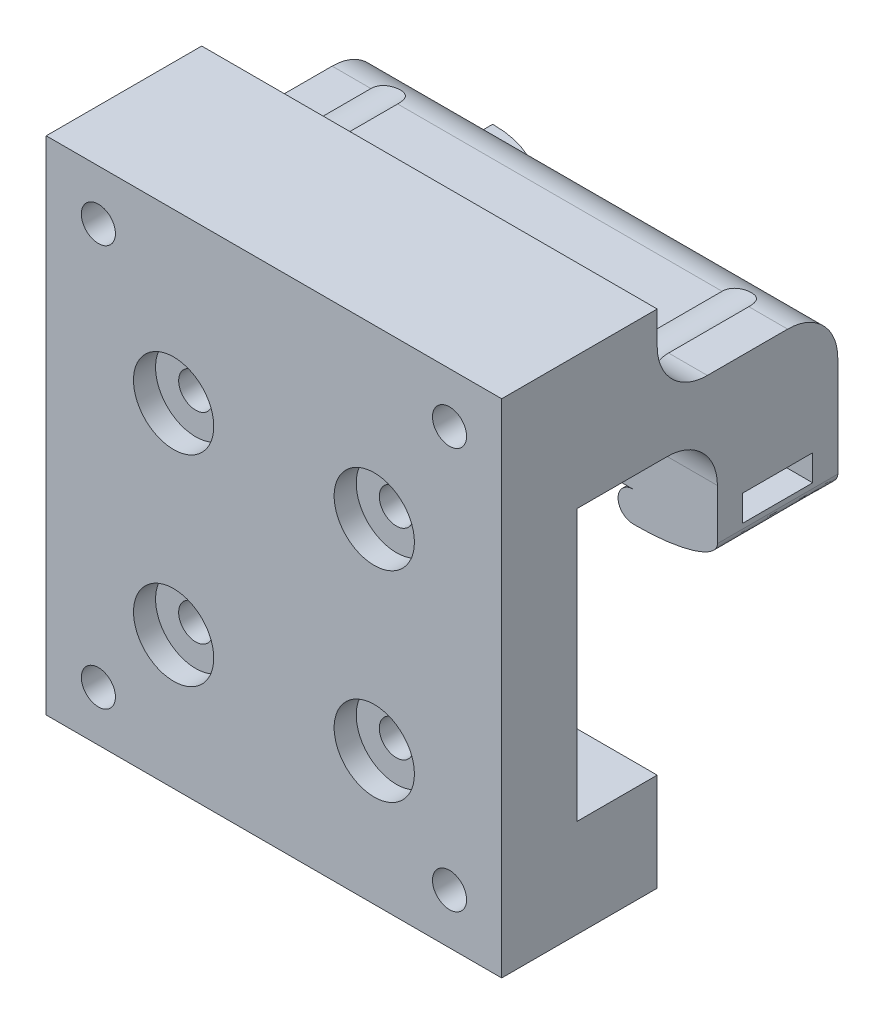
from build123d import *

# Parameters (mm, degrees)
SKETCH1_W           = 45.4
SKETCH1_H           = 50
BOSS_EXTRUDE1_DEPTH = 15.5
SKETCH2_W           = 45.4
SKETCH2_H           = 27
CUT_EXTRUDE1_DEPTH  = 8
SKETCH7_W           = 45.4
SKETCH7_H           = 5
BOSS_EXTRUDE2_DEPTH = 18
SKETCH8_W           = 45.4
SKETCH8_H           = 12
BOSS_EXTRUDE3_DEPTH = 12.52
CUT_EXTRUDE2_REACH  = 77.388
SKETCH11_W          = 7
SKETCH11_H          = 2.6
CUT_EXTRUDE3_DEPTH  = 70.893919621
FILLET1_SIZE        = 2.5
FILLET1_SIZE_2      = 8
CUT_EXTRUDE4_REACH  = 77.388
SKETCH13_R          = 1.7
SKETCH14_W          = 8
SKETCH14_H          = 1.5
BOSS_EXTRUDE4_DEPTH = 11
FILLET3_R           = 10
FILLET4_R           = 10
SKETCH15_R          = 1.7
CUT_EXTRUDE6_DEPTH  = 81.878983729
SKETCH16_R          = 3.5
CUT_EXTRUDE7_DEPTH  = 80.267963321
SKETCH17_R          = 4
CUT_EXTRUDE8_DEPTH  = 2.2
FILLET5_R           = 5
FILLET6_R           = 5
FILLET7_R           = 5
SKETCH18_R          = 1.35
CUT_EXTRUDE9_DEPTH  = 10


with BuildPart() as part:
    # Sketch1 → Boss-Extrude1 (new body)
    with BuildSketch(Plane.XY):
        with Locations((22.7, 25)):
            Rectangle(SKETCH1_W, SKETCH1_H)
    extrude(amount=BOSS_EXTRUDE1_DEPTH)

    # Sketch2 → Cut-Extrude1 (cut)
    with BuildSketch(Plane(origin=(0, 0, 0), x_dir=(-1, 0, 0), z_dir=(0, 0, -1))):
        with Locations((-22.7, 23.263256753)):
            Rectangle(SKETCH2_W, SKETCH2_H)
    extrude(amount=-CUT_EXTRUDE1_DEPTH, mode=Mode.SUBTRACT)

    # Sketch7 → Boss-Extrude2 (add)
    with BuildSketch(Plane(origin=(0, 0, 0), x_dir=(-1, 0, 0), z_dir=(0, 0, -1))):
        with Locations((-22.7, 39.263256753)):
            Rectangle(SKETCH7_W, SKETCH7_H)
    extrude(amount=BOSS_EXTRUDE2_DEPTH)

    # Sketch8 → Boss-Extrude3 (add)
    with BuildSketch(Plane.XZ.offset(-36.763256753)):
        with Locations((22.7, -12)):
            Rectangle(SKETCH8_W, SKETCH8_H)
    extrude(amount=BOSS_EXTRUDE3_DEPTH)

    # Sketch10 → Cut-Extrude2 (cut, up to next)
    with BuildSketch(Plane(origin=(0, 0, -18), x_dir=(-1, 0, 0), z_dir=(0, 0, -1)), mode=Mode.PRIVATE) as cut_extrude2_sk1:
        with BuildLine():
            Line((-37, 27.243256753), (-8, 27.243256753))
            ThreePointArc((-8, 27.243256753), (-9.5, 25.743256753), (-8, 24.243256753))
            Line((-8, 24.243256753), (-37, 24.243256753))
            ThreePointArc((-37, 24.243256753), (-35.5, 25.743256753), (-37, 27.243256753))
        make_face()
    cut_extrude2_tool1 = extrude(cut_extrude2_sk1.sketch, amount=-CUT_EXTRUDE2_REACH, mode=Mode.PRIVATE) & part.part
    add(cut_extrude2_tool1.solids().sort_by_distance((22.5, 25.743257, -18))[0], mode=Mode.SUBTRACT)

    # Sketch11 → Cut-Extrude3 (cut, through all)
    with BuildSketch(Plane(origin=(45.4, 0, 0), x_dir=(0, 0, -1), z_dir=(1, 0, 0))):
        with Locations((12, 28.543256753)):
            Rectangle(SKETCH11_W, SKETCH11_H)
    extrude(amount=-CUT_EXTRUDE3_DEPTH, mode=Mode.SUBTRACT)

    # Fillet1
    # an asymmetric fillet: 8, 2.5 mm, written as the material it takes off along each edge
    with BuildSketch(Plane(origin=(0, 24.243256753, 14), x_dir=(0, 1, 0), z_dir=(0, 0, -1))) as fillet1_piece_1_section:
        with BuildLine():
            Bezier((FILLET1_SIZE, 0), (0, 0), (0, FILLET1_SIZE_2), weights=[1, 0.707106781, 1])
            Line((0, FILLET1_SIZE_2), (0, 0))
            Line((0, 0), (FILLET1_SIZE, 0))
        make_face()
    fillet1_piece_1 = extrude(amount=52, mode=Mode.PRIVATE)
    fillet1_piece_1 = split(fillet1_piece_1, bisect_by=Plane(origin=(1.786931274, 24.8016736, 8), z_dir=(0, 0, -1)), keep=Keep.TOP, mode=Mode.PRIVATE)
    add(fillet1_piece_1, mode=Mode.SUBTRACT)
    with BuildSketch(Plane(origin=(45.4, 24.243256753, -38), x_dir=(0, 1, 0), z_dir=(0, 0, 1))) as fillet1_piece_2_section:
        with BuildLine():
            Bezier((FILLET1_SIZE, 0), (0, 0), (0, FILLET1_SIZE_2), weights=[1, 0.707106781, 1])
            Line((0, FILLET1_SIZE_2), (0, 0))
            Line((0, 0), (FILLET1_SIZE, 0))
        make_face()
    fillet1_piece_2 = extrude(amount=52, mode=Mode.PRIVATE)
    fillet1_piece_2 = split(fillet1_piece_2, bisect_by=Plane(origin=(43.613068726, 24.8016736, 8), z_dir=(0, 0, -1)), keep=Keep.TOP, mode=Mode.PRIVATE)
    add(fillet1_piece_2, mode=Mode.SUBTRACT)

    # Sketch13 → Cut-Extrude4 (cut, up to next)
    with BuildSketch(Plane.XY.offset(15.5), mode=Mode.PRIVATE) as cut_extrude4_sk1:
        with Locations((12.7, 33.263245951)):
            Circle(SKETCH13_R)
    cut_extrude4_tool1 = extrude(cut_extrude4_sk1.sketch, amount=-CUT_EXTRUDE4_REACH, mode=Mode.PRIVATE) & part.part
    # Sketch13 → Cut-Extrude4 (cut, up to next)
    with BuildSketch(Plane.XY.offset(15.5), mode=Mode.PRIVATE) as cut_extrude4_sk2:
        with Locations((32.7, 33.263245951)):
            Circle(SKETCH13_R)
    cut_extrude4_tool2 = extrude(cut_extrude4_sk2.sketch, amount=-CUT_EXTRUDE4_REACH, mode=Mode.PRIVATE) & part.part
    # Sketch13 → Cut-Extrude4 (cut, up to next)
    with BuildSketch(Plane.XY.offset(15.5), mode=Mode.PRIVATE) as cut_extrude4_sk3:
        with Locations((32.7, 13.263245951)):
            Circle(SKETCH13_R)
    cut_extrude4_tool3 = extrude(cut_extrude4_sk3.sketch, amount=-CUT_EXTRUDE4_REACH, mode=Mode.PRIVATE) & part.part
    # Sketch13 → Cut-Extrude4 (cut, up to next)
    with BuildSketch(Plane.XY.offset(15.5), mode=Mode.PRIVATE) as cut_extrude4_sk4:
        with Locations((12.7, 13.263245951)):
            Circle(SKETCH13_R)
    cut_extrude4_tool4 = extrude(cut_extrude4_sk4.sketch, amount=-CUT_EXTRUDE4_REACH, mode=Mode.PRIVATE) & part.part
    add(cut_extrude4_tool1.solids().sort_by_distance((12.7, 33.263246, 15.5))[0], mode=Mode.SUBTRACT)
    add(cut_extrude4_tool2.solids().sort_by_distance((32.7, 33.263246, 15.5))[0], mode=Mode.SUBTRACT)
    add(cut_extrude4_tool3.solids().sort_by_distance((32.7, 13.263246, 15.5))[0], mode=Mode.SUBTRACT)
    add(cut_extrude4_tool4.solids().sort_by_distance((12.7, 13.263246, 15.5))[0], mode=Mode.SUBTRACT)

    # Sketch14 → Boss-Extrude4 (add)
    with BuildSketch(Plane(origin=(0, 0, -18), x_dir=(-1, 0, 0), z_dir=(0, 0, -1))):
        with Locations((-4, 27.993256753)):
            Rectangle(SKETCH14_W, SKETCH14_H)
    extrude(amount=BOSS_EXTRUDE4_DEPTH)

    # Fillet3
    # the kernel refuses this fillet: 10 mm, written as the material it adds along each edge
    with BuildSketch(Plane(origin=(8, 28.743256753, -18), x_dir=(1, 0, 0), z_dir=(0, -1, 0))) as fillet3_piece_1:
        with BuildLine():
            CenterArc((FILLET3_R, -FILLET3_R), FILLET3_R, 90, 90)
            Line((0, -FILLET3_R), (0, 0))
            Line((0, 0), (FILLET3_R, 0))
        make_face()
    extrude(amount=1.5)

    # Fillet4
    # the kernel refuses this fillet: 10 mm, written as the material it takes off along each edge
    with BuildSketch(Plane(origin=(8, 48.394684502, -29), x_dir=(-1, 0, 0), z_dir=(0, -1, 0))) as fillet4_piece_1:
        with BuildLine():
            CenterArc((7.860571099, -10), FILLET4_R, 90, 63.25631605)
            Line((-1.06971445, -5.5), (-1.962743005, -5.05))
            ThreePointArc((-1.962743005, -5.05), (-1, -1), (-1, 0))
            Line((-1, 0), (0, 1))
            Line((0, 1), (7.860571099, 1))
            Line((7.860571099, 1), (7.860571099, 0))
        make_face()
    extrude(amount=40.802855497, mode=Mode.SUBTRACT)

    # Sketch15 → Cut-Extrude6 (cut, through all)
    with BuildSketch(Plane(origin=(0, 0, 15.5), x_dir=(-1, 0, 0), z_dir=(0, 0, -1))):
        with Locations((-5.2, 45)):
            Circle(SKETCH15_R)
        with Locations((-40.2, 45)):
            Circle(SKETCH15_R)
        with Locations((-40.2, 5)):
            Circle(SKETCH15_R)
        with Locations((-5.2, 5)):
            Circle(SKETCH15_R)
    extrude(amount=CUT_EXTRUDE6_DEPTH, mode=Mode.SUBTRACT)

    # Sketch16 → Cut-Extrude7 (cut, through all)
    with BuildSketch(Plane.XY.offset(12.5)):
        with Locations((5.2, 45)):
            Circle(SKETCH16_R)
        with Locations((40.2, 45)):
            Circle(SKETCH16_R)
        with Locations((40.2, 5)):
            Circle(SKETCH16_R)
        with Locations((5.2, 5)):
            Circle(SKETCH16_R)
    extrude(amount=-CUT_EXTRUDE7_DEPTH, mode=Mode.SUBTRACT)

    # Sketch17 → Cut-Extrude8 (cut)
    with BuildSketch(Plane.XY.offset(15.5)):
        with Locations((12.7, 33.263245951)):
            Circle(SKETCH17_R)
        with Locations((32.7, 33.263245951)):
            Circle(SKETCH17_R)
        with Locations((32.7, 13.263245951)):
            Circle(SKETCH17_R)
        with Locations((12.7, 13.263245951)):
            Circle(SKETCH17_R)
    extrude(amount=-CUT_EXTRUDE8_DEPTH, mode=Mode.SUBTRACT)

    # Fillet5
    fillet5_edges = [part.edges().sort_by_distance(p)[0] for p in [
        (22.7, 36.763256753, -6),
    ]]
    fillet(fillet5_edges, radius=FILLET5_R)

    # Fillet6
    fillet6_edges = [part.edges().sort_by_distance(p)[0] for p in [
        (22.7, 41.763256753, -18),
    ]]
    fillet(fillet6_edges, radius=FILLET6_R)

    # Fillet7
    # the kernel refuses this fillet: 5 mm, written as the material it adds along each edge
    with BuildSketch(Plane(origin=(51.368274369, 41.763256753, 0), x_dir=(0, 1, 0), z_dir=(-1, 0, 0))) as fillet7_piece_1_section:
        with BuildLine():
            CenterArc((FILLET7_R, FILLET7_R), FILLET7_R, 180, 90)
            Line((0, FILLET7_R), (0, 0))
            Line((0, 0), (FILLET7_R, 0))
        make_face()
    fillet7_piece_1 = extrude(amount=57.336548738, mode=Mode.PRIVATE)
    fillet7_piece_1 = split(fillet7_piece_1, bisect_by=Plane(origin=(0, 42.669837738, -1.260146255), z_dir=(1, 0, 0)), keep=Keep.TOP, mode=Mode.PRIVATE)
    fillet7_piece_1 = split(fillet7_piece_1, bisect_by=Plane(origin=(45.4, 42.669837738, -1.260146255), z_dir=(-1, 0, 0)), keep=Keep.TOP, mode=Mode.PRIVATE)
    fillet7_piece_1 = fillet7_piece_1 - Plane(origin=(40.2, 45, -1.260146255), x_dir=(1, 0, 0), z_dir=(0, 0, 1)) * Cylinder(3.5, 135, mode=Mode.PRIVATE)
    fillet7_piece_1 = fillet7_piece_1 - Plane(origin=(5.2, 45, -1.260146255), x_dir=(1, 0, 0), z_dir=(0, 0, 1)) * Cylinder(3.5, 135, mode=Mode.PRIVATE)
    with BuildSketch(Plane(origin=(45.4, 41.763256753, 0), x_dir=(0, 1, 0), z_dir=(-1, 0, 0))) as fillet7_piece_2_section:
        with BuildLine():
            CenterArc((FILLET7_R, FILLET7_R), FILLET7_R, 180, 90)
            Line((0, FILLET7_R), (0, 0))
            Line((0, 0), (FILLET7_R, 0))
        make_face()
    fillet7_piece_2 = extrude(amount=16.368274369, mode=Mode.PRIVATE)
    fillet7_piece_2 = fillet7_piece_2 - Plane(origin=(40.2, 45, -1.260146255), x_dir=(1, 0, 0), z_dir=(0, 0, 1)) * Cylinder(3.5, 53, mode=Mode.PRIVATE)
    with BuildSketch(Plane(origin=(16.368274369, 41.763256753, 0), x_dir=(0, 0, -1), z_dir=(-1, 0, 0))) as fillet7_piece_3_section:
        with BuildLine():
            CenterArc((FILLET7_R, -FILLET7_R), FILLET7_R, 90, 90)
            Line((0, -FILLET7_R), (0, 0))
            Line((0, 0), (FILLET7_R, 0))
        make_face()
    fillet7_piece_3 = extrude(amount=16.368274369, mode=Mode.PRIVATE)
    fillet7_piece_3 = fillet7_piece_3 - Plane(origin=(5.2, 45, -1.161012309), x_dir=(1, 0, 0), z_dir=(0, 0, 1)) * Cylinder(3.5, 53, mode=Mode.PRIVATE)
    add([fillet7_piece_1, fillet7_piece_2, fillet7_piece_3])

    # Sketch18 → Cut-Extrude9 (cut)
    with BuildSketch(Plane(origin=(0, 0, 0), x_dir=(-1, 0, 0), z_dir=(0, 0, -1))):
        with Locations((-32.4, 4.881628377)):
            Circle(SKETCH18_R)
        with Locations((-13, 4.881628377)):
            Circle(SKETCH18_R)
    extrude(amount=-CUT_EXTRUDE9_DEPTH, mode=Mode.SUBTRACT)


solid = part.part
